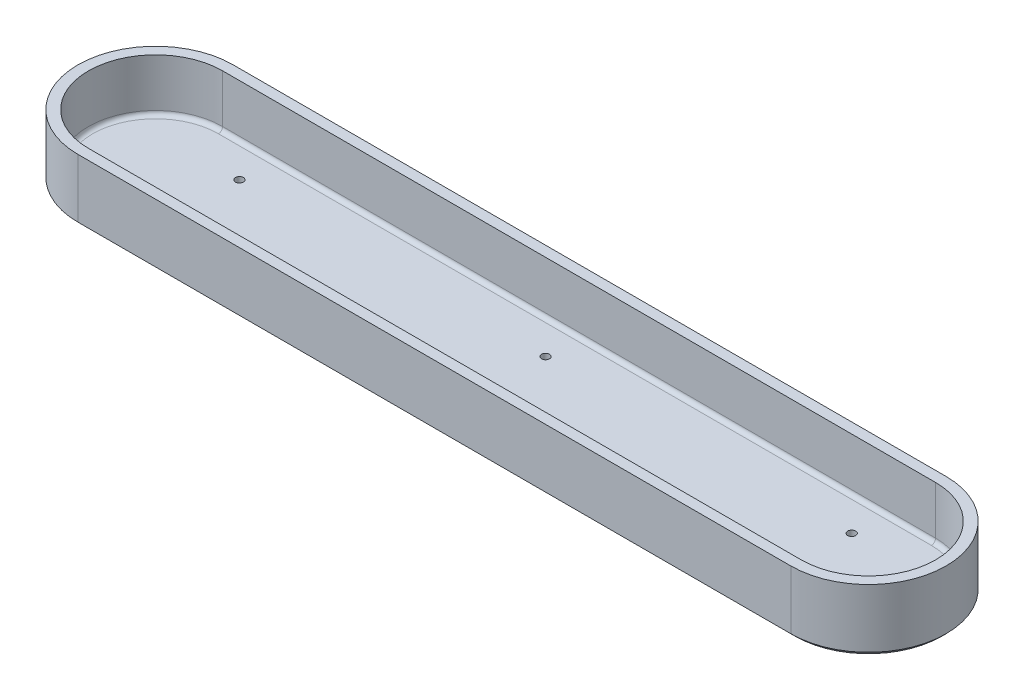
from build123d import *

# Parameters (mm, degrees)
MAINBLOCK_DEPTH     = 3.175
BOSS_EXTRUDE1_DEPTH = 19.05
SKETCH3_R           = 1.2065
CUT_EXTRUDE1_DEPTH  = 135.880337893
FILLET1_R           = 1.27
CHAMFER1_SIZE       = 1.27


with BuildPart() as part:
    # Sketch1 → MainBlock (new body)
    with BuildSketch(Plane(origin=(0, 0, 0), x_dir=(1, 0, 0), z_dir=(0, 1, 0))):
        with BuildLine():
            Line((-107.95, 20.32), (107.95, 20.32))
            ThreePointArc((107.95, 20.32), (128.27, 0), (107.95, -20.32))
            Line((107.95, -20.32), (-107.95, -20.32))
            ThreePointArc((-107.95, -20.32), (-128.27, 0), (-107.95, 20.32))
        make_face()
    extrude(amount=MAINBLOCK_DEPTH)

    # Sketch2 → Boss-Extrude1 (add)
    with BuildSketch(Plane.XZ):
        with BuildLine():
            Line((-107.95, 23.495), (107.95, 23.495))
            ThreePointArc((107.95, 23.495), (131.445, 0), (107.95, -23.495))
            Line((107.95, -23.495), (-107.95, -23.495))
            ThreePointArc((-107.95, -23.495), (-131.445, 0), (-107.95, 23.495))
        make_face()
        with BuildLine():
            Line((107.95, 20.32), (-107.95, 20.32))
            ThreePointArc((-107.95, 20.32), (-128.27, 0), (-107.95, -20.32))
            Line((-107.95, -20.32), (107.95, -20.32))
            ThreePointArc((107.95, -20.32), (128.27, 0), (107.95, 20.32))
        make_face(mode=Mode.SUBTRACT)
    extrude(amount=-BOSS_EXTRUDE1_DEPTH)

    # Sketch3 → Cut-Extrude1 (cut, through all)
    with BuildSketch(Plane.XZ):
        with Locations((0, 10.16)):
            Circle(SKETCH3_R)
        with Locations((-92.71, 10.16)):
            Circle(SKETCH3_R)
        with Locations((92.71, 10.16)):
            Circle(SKETCH3_R)
        with Locations((92.71, -10.16)):
            Circle(SKETCH3_R)
        with Locations((-92.71, -10.16)):
            Circle(SKETCH3_R)
        with Locations((0, -10.16)):
            Circle(SKETCH3_R)
    extrude(amount=-CUT_EXTRUDE1_DEPTH, mode=Mode.SUBTRACT)

    # Fillet1
    fillet1_edges = [part.edges().sort_by_distance(p)[0] for p in [
        (128.27, 3.175, 0),
        (0, 3.175, 20.32),
        (-128.27, 3.175, 0),
        (0, 3.175, -20.32),
    ]]
    fillet(fillet1_edges, radius=FILLET1_R)

    # Chamfer1
    chamfer1_edges = [part.edges().sort_by_distance(p)[0] for p in [
        (0, 0, 23.495),
        (-131.445, 0, 0),
        (131.445, 0, 0),
        (0, 0, -23.495),
    ]]
    chamfer(chamfer1_edges, length=CHAMFER1_SIZE)


solid = part.part
